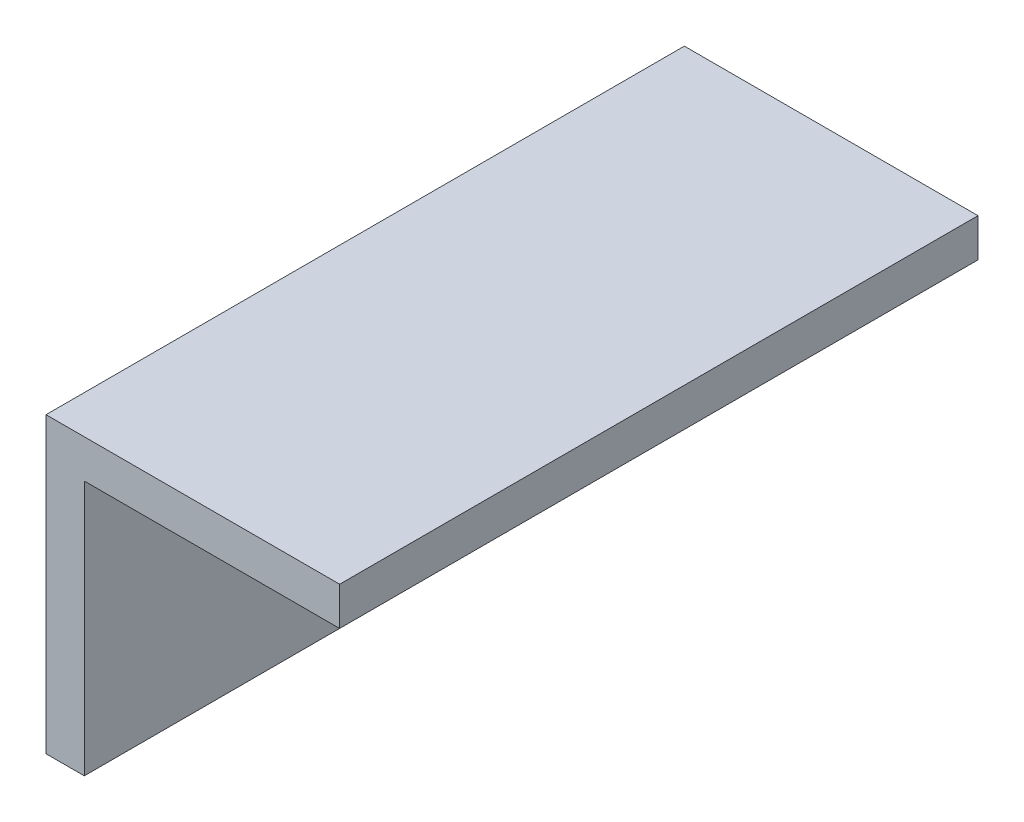
from build123d import *

# Parameters (mm, degrees)
BOSS_EXTRUDE1_DEPTH = 50


with BuildPart() as part:
    # Sketch1 → Boss-Extrude1 (new, symmetric)
    with BuildSketch(Plane.XY):
        Polygon((0, 0), (40, 0), (40, 6), (-6, 6), (-6, -40), (0, -40), align=None)
    extrude(amount=BOSS_EXTRUDE1_DEPTH, both=True)


solid = part.part
